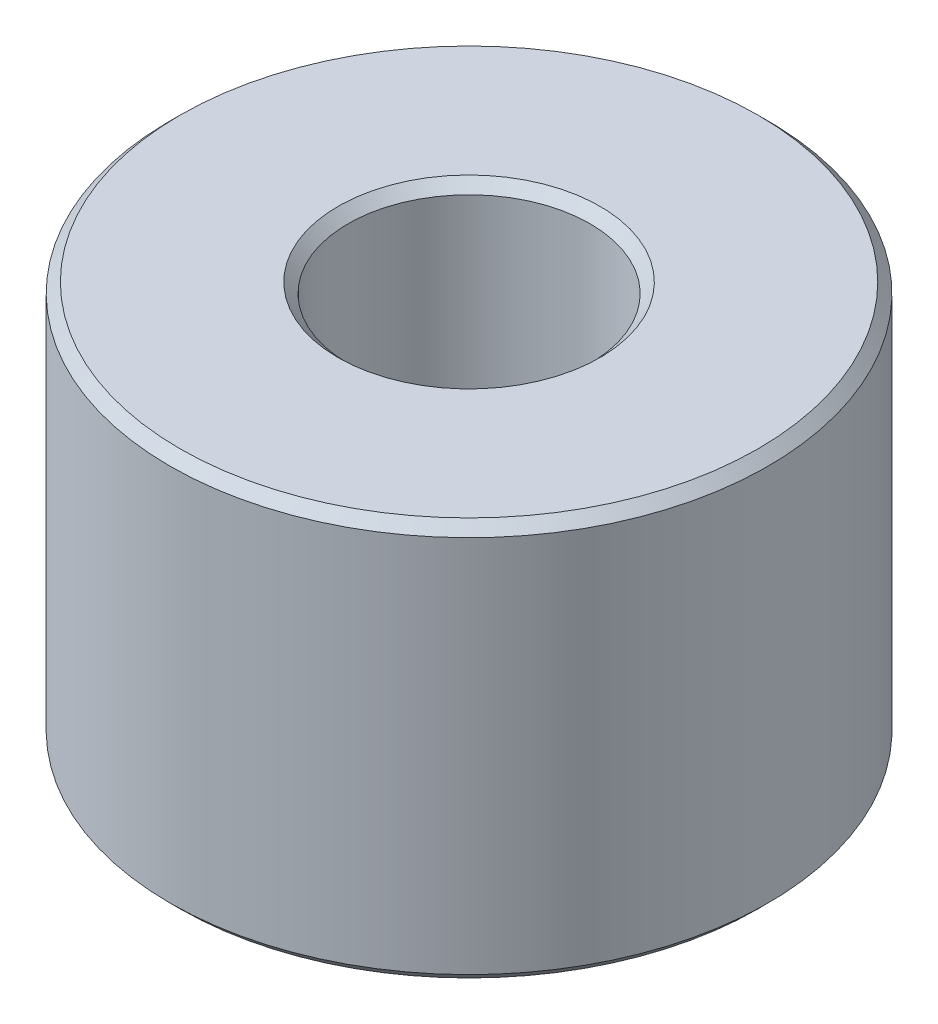
from build123d import *

# Parameters (mm, degrees)
SKETCH1_R           = 30
BOSS_EXTRUDE1_DEPTH = 39.97189929
SKETCH2_R           = 12.1393467
CUT_EXTRUDE1_DEPTH  = 59.290245606
CHAMFER1_SIZE       = 1.006274181


with BuildPart() as part:
    # Sketch1 → Boss-Extrude1 (new body)
    with BuildSketch(Plane(origin=(0, 0, 0), x_dir=(1, 0, 0), z_dir=(0, 1, 0))):
        Circle(SKETCH1_R)
    extrude(amount=BOSS_EXTRUDE1_DEPTH)

    # Sketch2 → Cut-Extrude1 (cut, through all)
    with BuildSketch(Plane(origin=(0, 0, 0), x_dir=(1, 0, 0), z_dir=(0, 1, 0))):
        Circle(SKETCH2_R)
    extrude(amount=CUT_EXTRUDE1_DEPTH, mode=Mode.SUBTRACT)

    # Chamfer1
    chamfer1_edges = [part.edges().sort_by_distance(p)[0] for p in [
        (-12.1393467, 39.97189929, 0),
        (-12.1393467, 0, 0),
        (-30, 0, 0),
        (-30, 39.97189929, 0),
    ]]
    chamfer(chamfer1_edges, length=CHAMFER1_SIZE)


solid = part.part
